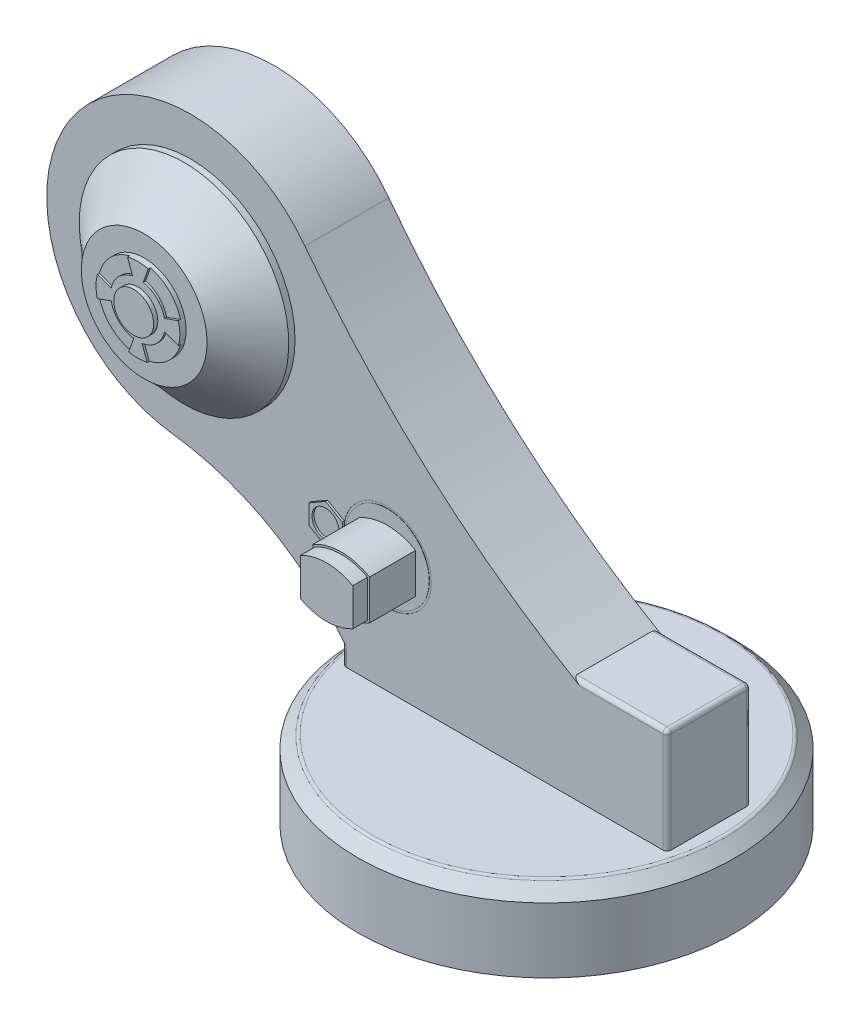
from build123d import *

# Parameters (mm, degrees)
SKETCH1_R            = 90
BOSS_EXTRUDE1_DEPTH  = 37
CHAMFER1_SIZE        = 6
SKETCH2_W            = 155
SKETCH2_H            = 40
BOSS_EXTRUDE2_DEPTH  = 50
CUT_EXTRUDE1_DEPTH   = 40
BOSS_EXTRUDE3_DEPTH  = 20
SKETCH8_R            = 50
BOSS_EXTRUDE4_DEPTH  = 3
SKETCH12_R           = 20
BOSS_EXTRUDE5_DEPTH  = 2
BOSS_EXTRUDE6_DEPTH  = 1
SKETCH14_R           = 9.5
BOSS_EXTRUDE7_DEPTH  = 2
BOSS_EXTRUDE9_DEPTH  = 22
BOSS_EXTRUDE10_DEPTH = 7
SKETCH18_R           = 6.5
BOSS_EXTRUDE11_DEPTH = 1
SKETCH19_R           = 21
SKETCH19_R_2         = 20
CUT_EXTRUDE12_DEPTH  = 0.1
FILLET1_R            = 2
SKETCH20_R           = 15
CUT_EXTRUDE13_DEPTH  = 20
SKETCH21_R           = 15
CUT_EXTRUDE14_DEPTH  = 20


with BuildPart() as part:
    # Sketch1 → Boss-Extrude1 (new body)
    with BuildSketch(Plane(origin=(0, 0, 0), x_dir=(1, 0, 0), z_dir=(0, 1, 0))):
        with Locations(Location((0, 0, 0), (0, 0, 270))):
            Circle(SKETCH1_R)
    extrude(amount=BOSS_EXTRUDE1_DEPTH)

    # Chamfer1
    chamfer1_edges = [part.edges().sort_by_distance(p)[0] for p in [
        (0, 37, -90),
    ]]
    chamfer(chamfer1_edges, length=CHAMFER1_SIZE)

    # Sketch2 → Boss-Extrude2 (add)
    with BuildSketch(Plane(origin=(0, 37, 0), x_dir=(1, 0, 0), z_dir=(0, 1, 0))):
        Rectangle(SKETCH2_W, SKETCH2_H)
    extrude(amount=BOSS_EXTRUDE2_DEPTH)

    # Sketch3 → Cut-Extrude1 (cut)
    with BuildSketch(Plane.XY.offset(20)):
        with BuildLine():
            Line((-77.5, 48), (-77.5, 87))
            Line((-77.5, 87), (32.5, 87))
            ThreePointArc((32.5, 87), (-18.551432041, 56.363013449), (-77.5, 48))
        make_face()
    extrude(amount=-CUT_EXTRUDE1_DEPTH, mode=Mode.SUBTRACT)

    # Sketch4 → Boss-Extrude3 (add, symmetric)
    with BuildSketch(Plane.XY):
        with BuildLine():
            ThreePointArc((-95.279461367, 201.205735666), (-209.325156185, 194.245814981), (-158.315351417, 92.00658171))
            ThreePointArc((-158.315351417, 92.00658171), (-113.710864551, 77.710473629), (-77.5, 48))
            ThreePointArc((-77.5, 48), (-18.551432041, 56.363013449), (32.5, 87))
            ThreePointArc((32.5, 87), (-37.003814726, 137.821531516), (-95.279461367, 201.205735666))
        make_face()
    extrude(amount=BOSS_EXTRUDE3_DEPTH, both=True)

    # Sketch8 → Boss-Extrude4 (add)
    with BuildSketch(Plane.XY.offset(20)):
        with Locations(Location((-150, 160, 0), (0, 0, 180))):
            Circle(SKETCH8_R)
    extrude(amount=BOSS_EXTRUDE4_DEPTH)

    # Loft2: read off the stored shape, not the designer's step
    # Loft2: loft between two sections, ruled curve by curve
    loft2_from = [
        Edge.make_bspline([(-197.405095184, 175.898331692, 23), (-229.201758567, 81.088141323, 23), (-134.391568199, 49.29147794, 23), (-102.594904816, 144.101668308, 23), (-70.798241433, 238.911858677, 23), (-165.608431801, 270.70852206, 23), (-197.405095184, 175.898331692, 23)], [0, 0, 0, 0, 0.5, 0.5, 0.5, 1, 1, 1, 1], 3, [1, 0.333333333, 0.333333333, 1, 0.333333333, 0.333333333, 1]),
    ]
    loft2_to = [
        Edge.make_bspline([(-179.935973003, 158.041041, 42), (-176.018055003, 98.169094994, 42), (-116.146108997, 102.087012994, 42), (-120.064026997, 161.958959, 42), (-123.981944997, 221.830905006, 42), (-183.853891003, 217.912987006, 42), (-179.935973003, 158.041041, 42)], [0, 0, 0, 0, 0.5, 0.5, 0.5, 1, 1, 1, 1], 3, [1, 0.333333333, 0.333333333, 1, 0.333333333, 0.333333333, 1]),
    ]
    loft2 = Solid(Shell([*[Face.make_surface_from_curves(loft2_from[k], loft2_to[k]) for k in range(1)], Face(Wire(loft2_from)), Face(Wire(loft2_to))]))
    add(loft2)

    # Sketch12 → Boss-Extrude5 (add)
    with BuildSketch(Plane.XY.offset(42)):
        with Locations((-150, 160)):
            Circle(SKETCH12_R)
    extrude(amount=BOSS_EXTRUDE5_DEPTH)

    # Sketch13 → Boss-Extrude6 (add)
    with BuildSketch(Plane.XY.offset(44)):
        with BuildLine():
            Line((-154.973420243, 179.371760144), (-152.561527516, 172.74513934))
            ThreePointArc((-152.561527516, 172.74513934), (-159.168635276, 169.216079816), (-162.73174885, 162.627274483))
            Line((-162.73174885, 162.627274483), (-169.355073812, 165.037967621))
            ThreePointArc((-169.355073812, 165.037967621), (-170, 160), (-169.355073812, 154.962032379))
            Line((-169.355073812, 154.962032379), (-162.73174885, 157.372725517))
            ThreePointArc((-162.73174885, 157.372725517), (-158.958779481, 150.579794577), (-151.985076295, 147.152452681))
            Line((-151.985076295, 147.152452681), (-154.409249727, 140.492090916))
            ThreePointArc((-154.409249727, 140.492090916), (-150, 140), (-145.590750273, 140.492090916))
            Line((-145.590750273, 140.492090916), (-148.014923705, 147.152452681))
            ThreePointArc((-148.014923705, 147.152452681), (-141.101752828, 150.522595436), (-137.302957602, 157.209818223))
            Line((-137.302957602, 157.209818223), (-130.687310868, 154.801919732))
            ThreePointArc((-130.687310868, 154.801919732), (-130.172572246, 157.378338566), (-130, 160))
            ThreePointArc((-130, 160), (-130.172572246, 162.621661434), (-130.687310868, 165.198080268))
            Line((-130.687310868, 165.198080268), (-137.302957602, 162.790181777))
            ThreePointArc((-137.302957602, 162.790181777), (-140.890593654, 169.274627541), (-147.438472484, 172.74513934))
            Line((-147.438472484, 172.74513934), (-145.026579757, 179.371760144))
            ThreePointArc((-145.026579757, 179.371760144), (-150, 180), (-154.973420243, 179.371760144))
        make_face()
    extrude(amount=BOSS_EXTRUDE6_DEPTH)

    # Sketch14 → Boss-Extrude7 (add)
    with BuildSketch(Plane.XY.offset(45)):
        with Locations((-150, 160)):
            Circle(SKETCH14_R)
    extrude(amount=BOSS_EXTRUDE7_DEPTH)

    # Sketch16 → Boss-Extrude9 (add)
    with BuildSketch(Plane.XY.offset(20)):
        with BuildLine():
            Line((-69.446792895, 101.883912358), (-69.446792895, 82.883912358))
            ThreePointArc((-69.446792895, 82.883912358), (-55.946792895, 79.266598261), (-42.446792895, 82.883912358))
            Line((-42.446792895, 82.883912358), (-42.446792895, 101.883912358))
            ThreePointArc((-42.446792895, 101.883912358), (-55.946792895, 105.501226456), (-69.446792895, 101.883912358))
        make_face()
    extrude(amount=BOSS_EXTRUDE9_DEPTH)

    # Sketch17 → Boss-Extrude10 (add)
    with BuildSketch(Plane.XY.offset(42)):
        with BuildLine():
            Line((-43.446792895, 83.46857203), (-43.446792895, 101.299252687))
            ThreePointArc((-43.446792895, 101.299252687), (-55.946792895, 104.501226456), (-68.446792895, 101.299252687))
            Line((-68.446792895, 101.299252687), (-68.446792895, 83.46857203))
            ThreePointArc((-68.446792895, 83.46857203), (-55.946792895, 80.266598261), (-43.446792895, 83.46857203))
        make_face()
    extrude(amount=BOSS_EXTRUDE10_DEPTH)

    # Sketch18 → Boss-Extrude11 (add)
    with BuildSketch(Plane.XY.offset(20)):
        Polygon((-84.446792895, 83.146308051), (-76.446792895, 87.765110205), (-76.446792895, 97.002714512), (-84.446792895, 101.621516665), (-92.446792895, 97.002714512), (-92.446792895, 87.765110205), align=None)
        with Locations((-84.446792895, 92.383912358)):
            Circle(SKETCH18_R, mode=Mode.SUBTRACT)
    extrude(amount=BOSS_EXTRUDE11_DEPTH)

    # Sketch19 → Cut-Extrude12 (cut)
    with BuildSketch(Plane.XY.offset(20)):
        with Locations((-55.946792895, 92.383912358)):
            Circle(SKETCH19_R)
        with Locations((-55.946792895, 92.383912358)):
            Circle(SKETCH19_R_2, mode=Mode.SUBTRACT)
    extrude(amount=-CUT_EXTRUDE12_DEPTH, mode=Mode.SUBTRACT)

    # Fillet1
    fillet1_edges = [part.edges().sort_by_distance(p)[0] for p in [
        (77.5, 62, 20),
        (77.5, 62, -20),
        (77.5, 87, 0),
        (55, 87, -20),
        (55, 87, 20),
        (-77.5, 42.5, 20),
        (-77.5, 42.5, -20),
        (0, 37, -84),
    ]]
    fillet(fillet1_edges, radius=FILLET1_R)

    # Sketch20 → Cut-Extrude13 (cut)
    with BuildSketch(Plane.XZ):
        with Locations(Location((0, 0, 0), (0, 0, 270))):
            Circle(SKETCH20_R)
    extrude(amount=-CUT_EXTRUDE13_DEPTH, mode=Mode.SUBTRACT)

    # Sketch21 → Cut-Extrude14 (cut)
    with BuildSketch(Plane(origin=(0, 0, -20), x_dir=(-1, 0, 0), z_dir=(0, 0, -1))):
        with Locations((150, 160)):
            Circle(SKETCH21_R)
    extrude(amount=-CUT_EXTRUDE14_DEPTH, mode=Mode.SUBTRACT)


solid = part.part
